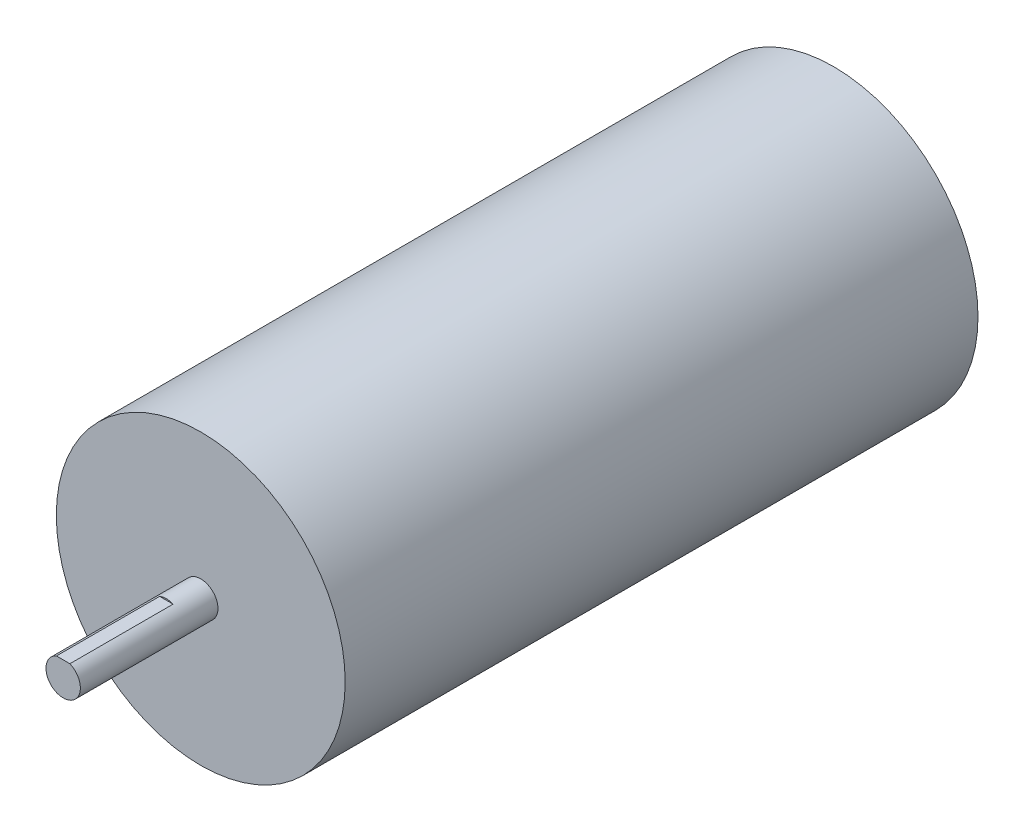
from build123d import *

# Parameters (mm, degrees)
ESBO_O1_R                = 21
RESSALTO_EXTRUS_O1_DEPTH = 92
ESBO_O2_R                = 2.5
RESSALTO_EXTRUS_O2_DEPTH = 20
CORTE_EXTRUS_O1_START    = -15
CORTE_EXTRUS_O1_DEPTH    = 15


with BuildPart() as part:
    # Esboço1 → Ressalto-extrusão1 (new body)
    with BuildSketch(Plane.XY):
        Circle(ESBO_O1_R)
    extrude(amount=RESSALTO_EXTRUS_O1_DEPTH)

    # Esboço2 → Ressalto-extrusão2 (add)
    with BuildSketch(Plane.XY.offset(92)):
        Circle(ESBO_O2_R)
    extrude(amount=RESSALTO_EXTRUS_O2_DEPTH)

    # Esboço3 → Corte-extrusão1 (cut)
    with BuildSketch(Plane.XY.offset(112).offset(CORTE_EXTRUS_O1_START)):
        with BuildLine():
            Line((-0.979795897, 2.3), (0.979795897, 2.3))
            ThreePointArc((0.979795897, 2.3), (0, 2.5), (-0.979795897, 2.3))
        make_face()
    extrude(amount=CORTE_EXTRUS_O1_DEPTH, mode=Mode.SUBTRACT)


solid = part.part
